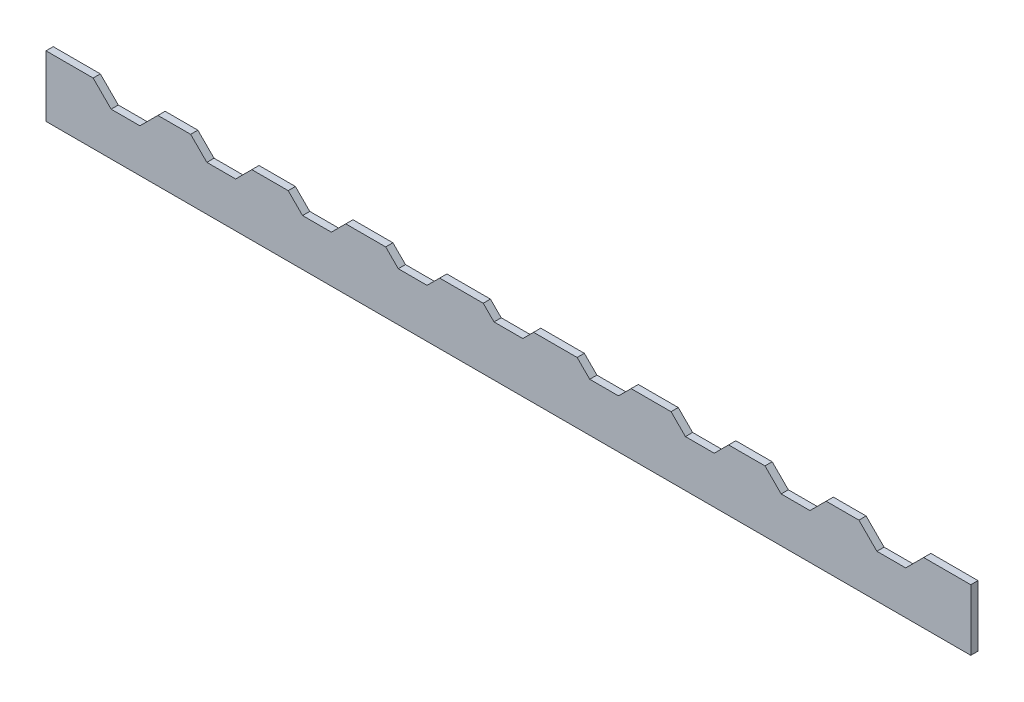
from build123d import *

# Parameters (mm, degrees)
SKETCH1_W             = 1285
SKETCH1_H             = 85
BOSS_EXTRUDE1_DEPTH   = 10
CUT_EXTRUDE1_REACH    = 650.175
SKETCH_PATTERN1_DEPTH = 10


# Read off the part's stored shape, not the designer's step: Sketch-Pattern1
with BuildPart() as part:
    # Sketch1 → Boss-Extrude1 (new body)
    with BuildSketch(Plane.XY):
        with Locations((0, 42.5)):
            Rectangle(SKETCH1_W, SKETCH1_H)
    extrude(amount=BOSS_EXTRUDE1_DEPTH)

    # Sketch2 → Cut-Extrude1 (cut, up to next)
    with BuildSketch(Plane.XY.offset(10), mode=Mode.PRIVATE) as cut_extrude1_sk1:
        Polygon((-50, 100), (-20, 70), (20, 70), (50, 100), align=None)
    cut_extrude1_tool1 = extrude(cut_extrude1_sk1.sketch, amount=-CUT_EXTRUDE1_REACH, mode=Mode.PRIVATE) & part.part
    add(cut_extrude1_tool1.solids().sort_by_distance((0, 87.142857, 10))[0], mode=Mode.SUBTRACT)

    # Sketch-Pattern1 outline → Sketch-Pattern1 (cut)
    with BuildSketch(Plane.XY):
        Polygon((-286, 65), (-246, 65), (-226, 85), (-306, 85), align=None)
        Polygon((-512, 60), (-487, 85), (-577, 85), (-552, 60), align=None)
        Polygon((-379, 62.5), (-356.5, 85), (-441.5, 85), (-419, 62.5), align=None)
        Polygon((-95.5, 85), (-170.5, 85), (-153, 67.5), (-113, 67.5), align=None)
    sketch_pattern1 = extrude(amount=SKETCH_PATTERN1_DEPTH, mode=Mode.SUBTRACT)

    # Mirror1: Sketch-Pattern1 across plane
    add(sketch_pattern1.mirror(Plane(origin=(0, 0, 0), x_dir=(0, 0, 1), z_dir=(1, 0, 0))), mode=Mode.SUBTRACT)


solid = part.part
